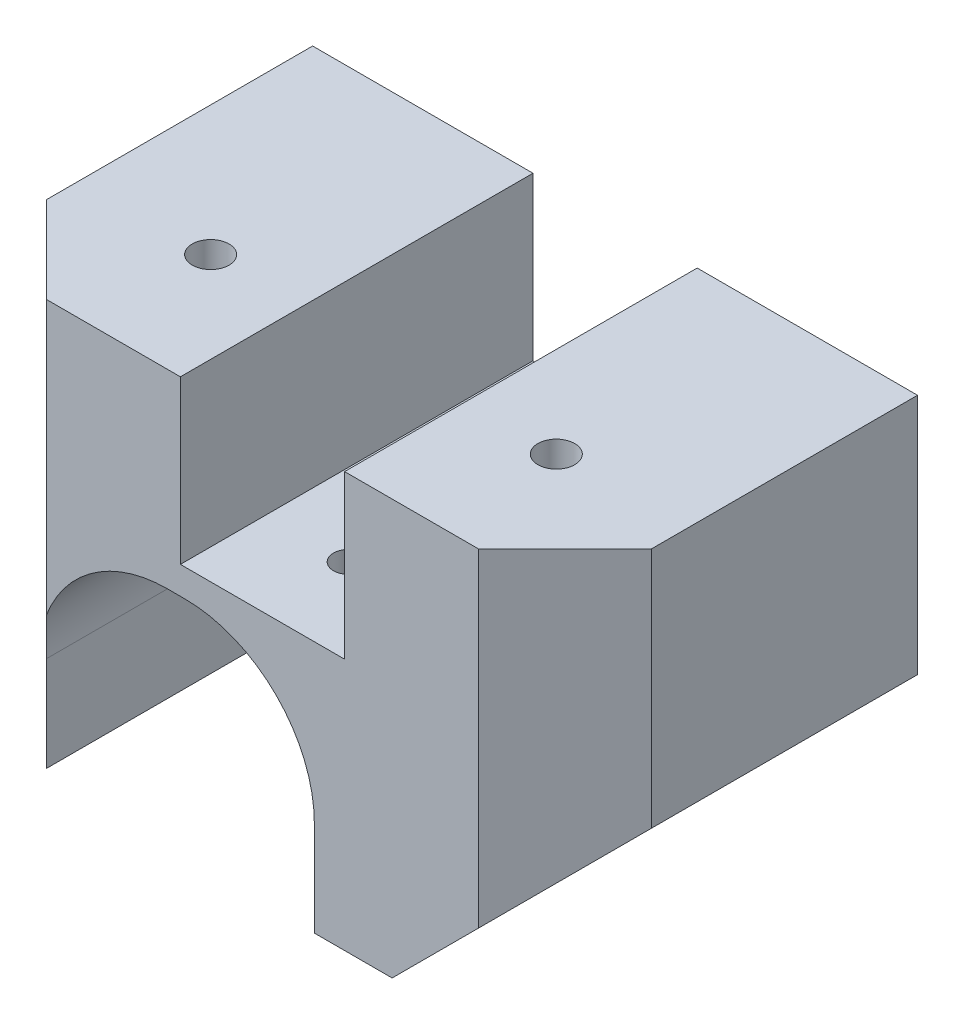
from build123d import *

# Parameters (mm, degrees)
SKETCH1_W                 = 44.45
SKETCH1_H                 = 25.908
BOSS_EXTRUDE1_DEPTH       = 30.48
SIDECHAMFER_SIZE          = 12.7
BACKCHAMFERS_SIZE         = 6.35
SKETCH2_W                 = 12.065
SKETCH2_H                 = 11.938
LINACTSLOT_DEPTH          = 46.762489978
MOUTINGHOLES_D            = 2.7051
MOUTINGHOLES_DEPTH        = 14.478
MOUTINGHOLES_TIP          = 0.81269403
CUT_EXTRUDE1_DEPTH        = 46.762489978
MOTORMOUNTINGHOLES2_D     = 2.2606
MOTORMOUNTINGHOLES2_DEPTH = 11.43
MOTORMOUNTINGHOLES2_TIP   = 0.679152758
GRIPPERSETSCREW_D         = 2.2606


with BuildPart() as part:
    # Sketch1 → Boss-Extrude1 (new body)
    with BuildSketch(Plane(origin=(0, 0, 0), x_dir=(1, 0, 0), z_dir=(0, 1, 0))):
        Rectangle(SKETCH1_W, SKETCH1_H)
    extrude(amount=BOSS_EXTRUDE1_DEPTH)

    # SideChamfer
    sidechamfer_edges = [part.edges().sort_by_distance(p)[0] for p in [
        (22.225, 0, 0),
    ]]
    chamfer(sidechamfer_edges, length=SIDECHAMFER_SIZE)

    # BackChamfers
    backchamfers_edges = [part.edges().sort_by_distance(p)[0] for p in [
        (-22.225, 15.24, 12.954),
        (22.225, 21.59, 12.954),
    ]]
    chamfer(backchamfers_edges, length=BACKCHAMFERS_SIZE)

    # Sketch2 → LinActSlot (cut, through all)
    with BuildSketch(Plane.XY.offset(12.954)):
        with Locations((0, 24.511)):
            Rectangle(SKETCH2_W, SKETCH2_H)
    extrude(amount=-LINACTSLOT_DEPTH, mode=Mode.SUBTRACT)

    # MoutingHoles
    with Locations(Plane(origin=(14.160350453, 30.48, 8.373414988), x_dir=(-1, 0, 0), z_dir=(0, 1, 0))):
        with Locations((1.460350453, -4.309414988), (26.860350453, -4.309414988)):
            Hole(MOUTINGHOLES_D / 2, depth=MOUTINGHOLES_DEPTH)
            with Locations((0, 0, -(MOUTINGHOLES_DEPTH + MOUTINGHOLES_TIP / 2))):  # 118° drill point
                Cone(0, MOUTINGHOLES_D / 2, MOUTINGHOLES_TIP, mode=Mode.SUBTRACT)

    # Sketch11 → Cut-Extrude1 (cut, through all)
    with BuildSketch(Plane(origin=(0, 0, -12.954), x_dir=(-1, 0, 0), z_dir=(0, 0, -1))):
        with BuildLine():
            Line((16.51, 6.35), (16.51, 6.985))
            ThreePointArc((16.51, 6.985), (13.720192091, 13.720192091), (6.985, 16.51))
            Line((6.985, 16.51), (5.715, 16.51))
            ThreePointArc((5.715, 16.51), (-1.020192091, 13.720192091), (-3.81, 6.985))
            Line((-3.81, 6.985), (-3.81, 6.35))
            Line((-3.81, 6.35), (-3.81, 0))
            Line((-3.81, 0), (16.51, 0))
            Line((16.51, 0), (16.51, 6.35))
        make_face()
    extrude(amount=-CUT_EXTRUDE1_DEPTH, mode=Mode.SUBTRACT)

    # MotorMountingHoles2
    with Locations(Plane(origin=(0, 0, -12.954), x_dir=(-1, 0, 0), z_dir=(0, 0, -1))):
        with Locations((18.8468, 6.985), (-6.1468, 6.985)):
            Hole(MOTORMOUNTINGHOLES2_D / 2, depth=MOTORMOUNTINGHOLES2_DEPTH)
            with Locations((0, 0, -(MOTORMOUNTINGHOLES2_DEPTH + MOTORMOUNTINGHOLES2_TIP / 2))):  # 118° drill point
                Cone(0, MOTORMOUNTINGHOLES2_D / 2, MOTORMOUNTINGHOLES2_TIP, mode=Mode.SUBTRACT)

    # GripperSetScrew (through all)
    with Locations(Plane(origin=(0, 18.542, 0), x_dir=(1, 0, 0), z_dir=(0, 1, 0))):
        with Locations((0, -6.604)):
            Hole(GRIPPERSETSCREW_D / 2)


solid = part.part
